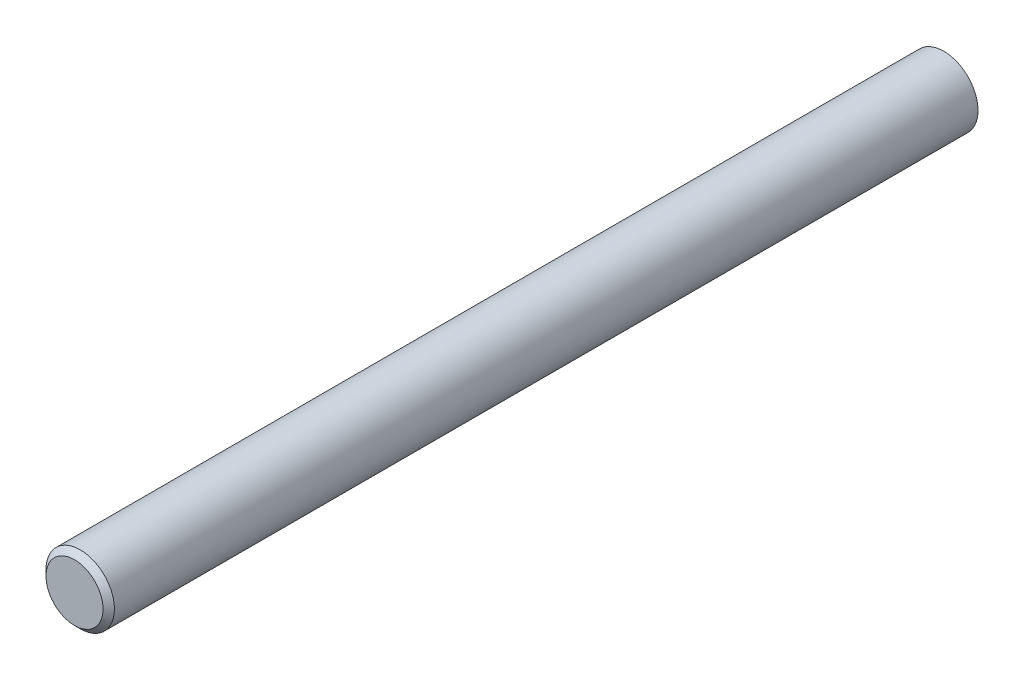
from build123d import *

# Parameters (mm, degrees)
FASE1_SIZE = 0.5


with BuildPart() as part:
    # Skizze1 → Rotation1 (revolve)
    with BuildSketch(Plane(origin=(0, 0, 0), x_dir=(0, 0, -1), z_dir=(1, 0, 0))):
        Polygon((7, 3), (2, 3), (-22, 3), (-22, 0), (0, 0), (54.21752089, 0), (54.21752089, 3), align=None)
    revolve(axis=Axis((0, 0, 22), (0, 0, -1)))

    # Fase1
    fase1_edges = [part.edges().sort_by_distance(p)[0] for p in [
        (0, -3, 22),
    ]]
    chamfer(fase1_edges, length=FASE1_SIZE)


solid = part.part
